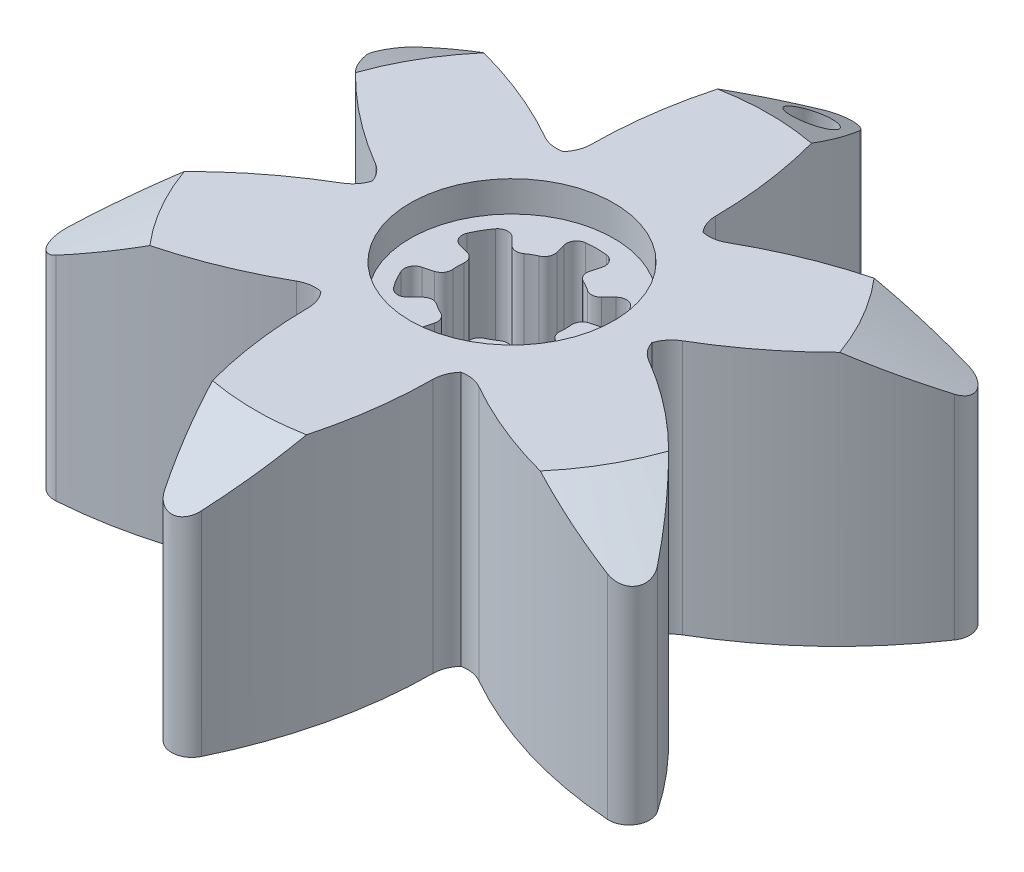
from build123d import *

# Parameters (mm, degrees)
SKETCH1_R               = 17.8
BOSS_EXTRUDE1_DEPTH     = 12.5
CHAMFER1_SIZE           = 3
CHAMFER1_SIZE2          = 5.196152423
CUT_EXTRUDE1_DEPTH      = 29.105693373
CUT_EXTRUDE2_DEPTH      = 27.659332496
SKETCH3_3_R             = 5
SKETCH3_3_R_2           = 4.15
CUT_EXTRUDE3_DEPTH      = 1.5
FILLET1_R               = 1
FILLET2_R               = 1.5
CUT_EXTRUDE4_DEPTH      = 26.464179365
CUT_EXTRUDE4_DEPTH_BACK = 9
SKETCH5_R               = 1
CUT_EXTRUDE5_DEPTH      = 26.464179365
FILLET3_R               = 0.5


with BuildPart() as part:
    # Sketch1 → Boss-Extrude1 (new body)
    with BuildSketch(Plane(origin=(0, 0, 0), x_dir=(1, 0, 0), z_dir=(0, 1, 0))):
        with Locations(Location((0, 0, 0), (0, 0, 270))):
            Circle(SKETCH1_R)
    extrude(amount=BOSS_EXTRUDE1_DEPTH)

    # Chamfer1
    chamfer1_edges = [part.edges().sort_by_distance(p)[0] for p in [
        (0, 12.5, -17.8),
    ]]
    chamfer1_side = [part.faces().sort_by_distance(p)[0] for p in [
        (0, 6.25, -17.8),
    ]]
    chamfer(chamfer1_edges, length=CHAMFER1_SIZE, length2=CHAMFER1_SIZE2, reference=chamfer1_side[0])

    # Sketch2 → Cut-Extrude1 (cut, through all)
    with BuildSketch(Plane(origin=(0, 12.5, 0), x_dir=(1, 0, 0), z_dir=(0, 1, 0))):
        with BuildLine():
            ThreePointArc((15.415252187, 8.9), (8.9, 15.415252187), (0, 17.8))
            ThreePointArc((0, 17.8), (2.273382377, 12.507506023), (3.05, 6.8))
            Line((3.05, 6.8), (3.05, 6.077622891))
            ThreePointArc((3.05, 6.077622891), (3.4, 5.888972746), (3.738375818, 5.680188927))
            Line((3.738375818, 5.680188927), (4.363972746, 6.041377482))
            ThreePointArc((4.363972746, 6.041377482), (9.695126765, 8.222559903), (15.415252187, 8.9))
        make_face()
        with BuildLine():
            ThreePointArc((17.8, 0), (17.193479708, 4.606979003), (15.415252187, 8.9))
            ThreePointArc((15.415252187, 8.9), (11.968509142, 4.28494612), (7.413972746, 0.758622518))
            Line((7.413972746, 0.758622518), (6.788375818, 0.397433964))
            ThreePointArc((6.788375818, 0.397433964), (6.797093333, 0.19880196), (6.8, 0))
            ThreePointArc((6.8, 0), (6.797093333, -0.19880196), (6.788375818, -0.397433964))
            Line((6.788375818, -0.397433964), (7.413972746, -0.758622518))
            ThreePointArc((7.413972746, -0.758622518), (11.968509142, -4.28494612), (15.415252187, -8.9))
            ThreePointArc((15.415252187, -8.9), (17.193479708, -4.606979003), (17.8, 0))
        make_face()
        with BuildLine():
            ThreePointArc((0, -17.8), (8.9, -15.415252187), (15.415252187, -8.9))
            ThreePointArc((15.415252187, -8.9), (9.695126765, -8.222559903), (4.363972746, -6.041377482))
            Line((4.363972746, -6.041377482), (3.738375818, -5.680188927))
            ThreePointArc((3.738375818, -5.680188927), (3.4, -5.888972746), (3.05, -6.077622891))
            Line((3.05, -6.077622891), (3.05, -6.8))
            ThreePointArc((3.05, -6.8), (2.273382377, -12.507506023), (0, -17.8))
        make_face()
        with BuildLine():
            ThreePointArc((-4.363972746, -6.041377482), (-9.695126765, -8.222559903), (-15.415252187, -8.9))
            ThreePointArc((-15.415252187, -8.9), (-8.9, -15.415252187), (0, -17.8))
            ThreePointArc((0, -17.8), (-2.273382377, -12.507506023), (-3.05, -6.8))
            Line((-3.05, -6.8), (-3.05, -6.077622891))
            ThreePointArc((-3.05, -6.077622891), (-3.4, -5.888972746), (-3.738375818, -5.680188927))
            Line((-3.738375818, -5.680188927), (-4.363972746, -6.041377482))
        make_face()
        with BuildLine():
            ThreePointArc((-7.413972746, 0.758622518), (-11.968509142, 4.28494612), (-15.415252187, 8.9))
            ThreePointArc((-15.415252187, 8.9), (-17.8, 0), (-15.415252187, -8.9))
            ThreePointArc((-15.415252187, -8.9), (-11.968509142, -4.28494612), (-7.413972746, -0.758622518))
            Line((-7.413972746, -0.758622518), (-6.788375818, -0.397433964))
            ThreePointArc((-6.788375818, -0.397433964), (-6.8, 0), (-6.788375818, 0.397433964))
            Line((-6.788375818, 0.397433964), (-7.413972746, 0.758622518))
        make_face()
        with BuildLine():
            Line((-3.05, 6.077622891), (-3.05, 6.8))
            ThreePointArc((-3.05, 6.8), (-2.273382377, 12.507506023), (0, 17.8))
            ThreePointArc((0, 17.8), (-8.9, 15.415252187), (-15.415252187, 8.9))
            ThreePointArc((-15.415252187, 8.9), (-9.695126765, 8.222559903), (-4.363972746, 6.041377482))
            Line((-4.363972746, 6.041377482), (-3.738375818, 5.680188927))
            ThreePointArc((-3.738375818, 5.680188927), (-3.4, 5.888972746), (-3.05, 6.077622891))
        make_face()
    extrude(amount=-CUT_EXTRUDE1_DEPTH, mode=Mode.SUBTRACT)

    # Sketch3 → Cut-Extrude2 (cut, through all)
    with BuildSketch(Plane(origin=(0, 12.5, 0), x_dir=(1, 0, 0), z_dir=(0, 1, 0))):
        with BuildLine():
            ThreePointArc((1.87383297, 1.87383297), (1.325, 2.29496732), (0.68587047, 2.55970344))
            Line((0.68587047, 2.55970344), (1.074099037, 4.008592179))
            ThreePointArc((1.074099037, 4.008592179), (0, 4.15), (-1.074099037, 4.008592179))
            Line((-1.074099037, 4.008592179), (-0.68587047, 2.55970344))
            ThreePointArc((-0.68587047, 2.55970344), (-1.325, 2.29496732), (-1.87383297, 1.87383297))
            Line((-1.87383297, 1.87383297), (-2.934493142, 2.934493142))
            ThreePointArc((-2.934493142, 2.934493142), (-3.594005426, 2.075), (-4.008592179, 1.074099037))
            Line((-4.008592179, 1.074099037), (-2.55970344, 0.68587047))
            ThreePointArc((-2.55970344, 0.68587047), (-2.65, 0), (-2.55970344, -0.68587047))
            Line((-2.55970344, -0.68587047), (-4.008592179, -1.074099037))
            ThreePointArc((-4.008592179, -1.074099037), (-3.594005426, -2.075), (-2.934493142, -2.934493142))
            Line((-2.934493142, -2.934493142), (-1.87383297, -1.87383297))
            ThreePointArc((-1.87383297, -1.87383297), (-1.325, -2.29496732), (-0.68587047, -2.55970344))
            Line((-0.68587047, -2.55970344), (-1.074099037, -4.008592179))
            ThreePointArc((-1.074099037, -4.008592179), (0, -4.15), (1.074099037, -4.008592179))
            Line((1.074099037, -4.008592179), (0.68587047, -2.55970344))
            ThreePointArc((0.68587047, -2.55970344), (1.325, -2.29496732), (1.87383297, -1.87383297))
            Line((1.87383297, -1.87383297), (2.934493142, -2.934493142))
            ThreePointArc((2.934493142, -2.934493142), (3.594005426, -2.075), (4.008592179, -1.074099037))
            Line((4.008592179, -1.074099037), (2.55970344, -0.68587047))
            ThreePointArc((2.55970344, -0.68587047), (2.65, 0), (2.55970344, 0.68587047))
            Line((2.55970344, 0.68587047), (4.008592179, 1.074099037))
            ThreePointArc((4.008592179, 1.074099037), (3.594005426, 2.075), (2.934493142, 2.934493142))
            Line((2.934493142, 2.934493142), (1.87383297, 1.87383297))
        make_face()
    extrude(amount=-CUT_EXTRUDE2_DEPTH, mode=Mode.SUBTRACT)

    # Sketch3<3> → Cut-Extrude3 (cut)
    # profile 1 of 7: a face of its own
    with BuildSketch(Plane(origin=(0, 12.5, 0), x_dir=(1, 0, 0), z_dir=(0, 1, 0))):
        with Locations(Location((0, 0, 0), (0, 0, 270))):
            Circle(SKETCH3_3_R)
        Circle(SKETCH3_3_R_2, mode=Mode.SUBTRACT)
    # profile 2 of 7: a face of its own
    with BuildSketch(Plane(origin=(0, 12.5, 0), x_dir=(1, 0, 0), z_dir=(0, 1, 0))):
        with BuildLine():
            Line((1.074099037, 4.008592179), (0.68587047, 2.55970344))
            ThreePointArc((0.68587047, 2.55970344), (1.325, 2.29496732), (1.87383297, 1.87383297))
            Line((1.87383297, 1.87383297), (2.934493142, 2.934493142))
            ThreePointArc((2.934493142, 2.934493142), (2.075, 3.594005426), (1.074099037, 4.008592179))
        make_face()
    # profile 3 of 7: a face of its own
    with BuildSketch(Plane(origin=(0, 12.5, 0), x_dir=(1, 0, 0), z_dir=(0, 1, 0))):
        with BuildLine():
            Line((-0.68587047, 2.55970344), (-1.074099037, 4.008592179))
            ThreePointArc((-1.074099037, 4.008592179), (-2.075, 3.594005426), (-2.934493142, 2.934493142))
            Line((-2.934493142, 2.934493142), (-1.87383297, 1.87383297))
            ThreePointArc((-1.87383297, 1.87383297), (-1.325, 2.29496732), (-0.68587047, 2.55970344))
        make_face()
    # profile 4 of 7: a face of its own
    with BuildSketch(Plane(origin=(0, 12.5, 0), x_dir=(1, 0, 0), z_dir=(0, 1, 0))):
        with BuildLine():
            Line((-2.55970344, 0.68587047), (-4.008592179, 1.074099037))
            ThreePointArc((-4.008592179, 1.074099037), (-4.15, 0), (-4.008592179, -1.074099037))
            Line((-4.008592179, -1.074099037), (-2.55970344, -0.68587047))
            ThreePointArc((-2.55970344, -0.68587047), (-2.65, 0), (-2.55970344, 0.68587047))
        make_face()
    # profile 5 of 7: a face of its own
    with BuildSketch(Plane(origin=(0, 12.5, 0), x_dir=(1, 0, 0), z_dir=(0, 1, 0))):
        with BuildLine():
            Line((-1.87383297, -1.87383297), (-2.934493142, -2.934493142))
            ThreePointArc((-2.934493142, -2.934493142), (-2.075, -3.594005426), (-1.074099037, -4.008592179))
            Line((-1.074099037, -4.008592179), (-0.68587047, -2.55970344))
            ThreePointArc((-0.68587047, -2.55970344), (-1.325, -2.29496732), (-1.87383297, -1.87383297))
        make_face()
    # profile 6 of 7: a face of its own
    with BuildSketch(Plane(origin=(0, 12.5, 0), x_dir=(1, 0, 0), z_dir=(0, 1, 0))):
        with BuildLine():
            ThreePointArc((1.074099037, -4.008592179), (2.075, -3.594005426), (2.934493142, -2.934493142))
            Line((2.934493142, -2.934493142), (1.87383297, -1.87383297))
            ThreePointArc((1.87383297, -1.87383297), (1.325, -2.29496732), (0.68587047, -2.55970344))
            Line((0.68587047, -2.55970344), (1.074099037, -4.008592179))
        make_face()
    # profile 7 of 7: a face of its own
    with BuildSketch(Plane(origin=(0, 12.5, 0), x_dir=(1, 0, 0), z_dir=(0, 1, 0))):
        with BuildLine():
            ThreePointArc((4.15, 0), (4.114496175, 0.541683698), (4.008592179, 1.074099037))
            Line((4.008592179, 1.074099037), (2.55970344, 0.68587047))
            ThreePointArc((2.55970344, 0.68587047), (2.65, 0), (2.55970344, -0.68587047))
            Line((2.55970344, -0.68587047), (4.008592179, -1.074099037))
            ThreePointArc((4.008592179, -1.074099037), (4.114496175, -0.541683698), (4.15, 0))
        make_face()
    extrude(amount=-CUT_EXTRUDE3_DEPTH, mode=Mode.SUBTRACT)

    # Fillet1
    fillet1_edges = [part.edges().sort_by_distance(p)[0] for p in [
        (-15.415252187, 4.75, 8.9),
        (-15.415252187, 4.75, -8.9),
        (0, 4.75, -17.8),
        (15.415252187, 4.75, -8.9),
        (0, 4.75, 17.8),
        (15.415252187, 4.75, 8.9),
    ]]
    fillet(fillet1_edges, radius=FILLET1_R)

    # Fillet2
    # the kernel refuses this fillet: 1.5 mm, written as the material it adds along each edge
    with BuildSketch(Plane(origin=(3.05, 12.5, 6.077622891), x_dir=(-0.00048199779843659105, 0, 0.9999998838390544), z_dir=(0, -1, 0)), Plane(origin=(6.788375818, 12.5, 0.397433964), x_dir=(0.8657843042869479, 0, 0.5004173642574423), z_dir=(0, -1, 0)), Plane(origin=(3.738375818, 12.5, -5.680188927), x_dir=(0.8662663020854502, 0, -0.4995825195812995), z_dir=(0, -1, 0))) as fillet2_piece_1:
        with BuildLine():
            CenterArc((0.863665004, -1.499975376), FILLET2_R, 90.328301817, 56.404604644)
            Line((-0.390518808, -0.677161324), (-0.515937189, -0.594879918))
            ThreePointArc((-0.515937189, -0.594879918), (-0.315461308, -0.269260246), (-0.134032767, 0.067344023))
            Line((-0.134032767, 0.067344023), (7.23e-05, 0.149999983))
            ThreePointArc((7.23e-05, 0.149999983), (0.722449325, 0.149651798), (0.854210642, 0.149997538))
            Line((0.854210642, 0.149997538), (0.85507013, 0))
        make_face()
    extrude(amount=12.5)
    with BuildSketch(Plane(origin=(3.738375818, 12.5, 5.680188927), x_dir=(-0.8655400074803123, 0, 0.5008397902033951), z_dir=(0, -1, 0)), Plane(origin=(6.788375818, 12.5, -0.397433964), x_dir=(0.0009699778017299519, 0, 0.9999995295714215), z_dir=(0, -1, 0)), Plane(origin=(3.05, 12.5, -6.077622891), x_dir=(0.8665099852823465, 0, 0.49915973936805796), z_dir=(0, -1, 0))) as fillet2_piece_2:
        with BuildLine():
            CenterArc((0.867915142, -1.497520175), FILLET2_R, 93.295052741, 56.404604644)
            Line((-0.427173659, -0.740720995), (-0.556682539, -0.665041077))
            ThreePointArc((-0.556682539, -0.665041077), (-0.490558067, -0.551073018), (-0.129976498, 0.074873961))
            Line((-0.129976498, 0.074873961), (0.008621674, 0.149752017))
            ThreePointArc((0.008621674, 0.149752017), (0.390849203, 0.138758127), (0.773076732, 0.149752017))
            Line((0.773076732, 0.149752017), (0.781698406, 0))
        make_face()
    extrude(amount=12.5)
    with BuildSketch(Plane(origin=(-3.738375818, 12.5, 5.680188927), x_dir=(0.8655400074804652, 0, 0.5008397902031311), z_dir=(0, -1, 0)), Plane(origin=(-6.788375818, 12.5, -0.397433964), x_dir=(-0.0009699778021795972, 0, 0.999999529571421), z_dir=(0, -1, 0)), Plane(origin=(-3.05, 12.5, -6.077622891), x_dir=(-0.8665099852823467, 0, 0.49915973936805774), z_dir=(0, -1, 0))) as fillet2_piece_3:
        with BuildLine():
            CenterArc((0.867915142, 1.497520175), FILLET2_R, 210.300342615, 56.404604644)
            Line((-0.427173659, 0.740720995), (-0.556682539, 0.665041077))
            ThreePointArc((-0.556682539, 0.665041077), (-0.490558067, 0.551073018), (-0.129976498, -0.074873961))
            Line((-0.129976498, -0.074873961), (0.008621674, -0.149752017))
            ThreePointArc((0.008621674, -0.149752017), (0.390849203, -0.138758127), (0.773076732, -0.149752017))
            Line((0.773076732, -0.149752017), (0.781698406, 0))
        make_face()
    extrude(amount=12.5)
    with BuildSketch(Plane(origin=(-3.05, 12.5, 6.077622891), x_dir=(0.00048199779885955805, 0, 0.9999998838390541), z_dir=(0, -1, 0)), Plane(origin=(-6.788375818, 12.5, 0.397433964), x_dir=(-0.8657843042866001, 0, 0.500417364258044), z_dir=(0, -1, 0)), Plane(origin=(-3.738375818, 12.5, -5.680188927), x_dir=(-0.8662663020855745, 0, -0.49958251958108396), z_dir=(0, -1, 0))) as fillet2_piece_4:
        with BuildLine():
            CenterArc((0.863665004, 1.499975376), FILLET2_R, 213.267093538, 56.404604644)
            Line((-0.390518808, 0.677161324), (-0.515937189, 0.594879918))
            ThreePointArc((-0.515937189, 0.594879918), (-0.315461308, 0.269260246), (-0.134032767, -0.067344023))
            Line((-0.134032767, -0.067344023), (7.23e-05, -0.149999983))
            ThreePointArc((7.23e-05, -0.149999983), (0.722449325, -0.149651798), (0.854210642, -0.149997538))
            Line((0.854210642, -0.149997538), (0.85507013, 0))
        make_face()
    extrude(amount=12.5)

    # Sketch4 → Cut-Extrude4 (cut, two sides: drawn at the far end of the back side and taken through both)
    with BuildSketch(Plane.XZ.offset(-CUT_EXTRUDE4_DEPTH_BACK)):
        with BuildLine():
            ThreePointArc((-2.219953239, 4.480157097), (0, 5), (2.219953239, 4.480157097))
            Line((2.219953239, 4.480157097), (2.5, 4.965212315))
            Line((2.5, 4.965212315), (2.770864683, 5.434363708))
            ThreePointArc((2.770864683, 5.434363708), (2.685698645, 5.476953787), (2.599878168, 5.518209267))
            ThreePointArc((2.599878168, 5.518209267), (2.187128312, 5.878639709), (2.02629493, 6.402476679))
            ThreePointArc((2.02629493, 6.402476679), (1.516680759, 10.735395398), (0.183644193, 14.889538481))
            ThreePointArc((0.183644193, 14.889538481), (0, 15.010324782), (-0.183644193, 14.889538481))
            ThreePointArc((-0.183644193, 14.889538481), (-1.516680759, 10.735395398), (-2.02629493, 6.402476679))
            ThreePointArc((-2.02629493, 6.402476679), (-2.187128312, 5.878639709), (-2.599878168, 5.518209267))
            ThreePointArc((-2.599878168, 5.518209267), (-2.685698645, 5.476953787), (-2.770864683, 5.434363708))
            Line((-2.770864683, 5.434363708), (-2.219953239, 4.480157097))
        make_face()
        with BuildLine():
            ThreePointArc((-4.989906479, 0.317542648), (-4.330127019, 2.5), (-2.769953239, 4.162614449))
            Line((-2.769953239, 4.162614449), (-3.320864683, 5.11682106))
            ThreePointArc((-3.320864683, 5.11682106), (-3.400331793, 5.064360147), (-3.478970325, 5.010665174))
            ThreePointArc((-3.478970325, 5.010665174), (-3.997487172, 4.833428534), (-4.531559986, 4.956061224))
            ThreePointArc((-4.531559986, 4.956061224), (-8.538784755, 6.681181766), (-12.802896479, 7.603809777))
            ThreePointArc((-12.802896479, 7.603809777), (-12.99932258, 7.505162391), (-12.986540672, 7.285728704))
            ThreePointArc((-12.986540672, 7.285728704), (-10.055465514, 4.054213633), (-6.557854916, 1.446415454))
            ThreePointArc((-6.557854916, 1.446415454), (-6.184615484, 1.045211175), (-6.078848492, 0.507544093))
            ThreePointArc((-6.078848492, 0.507544093), (-6.086030438, 0.41259364), (-6.091729366, 0.317542648))
            Line((-6.091729366, 0.317542648), (-4.989906479, 0.317542648))
        make_face()
        with BuildLine():
            Line((-3.320864683, -5.11682106), (-2.769953239, -4.162614449))
            ThreePointArc((-2.769953239, -4.162614449), (-4.330127019, -2.5), (-4.989906479, -0.317542648))
            Line((-4.989906479, -0.317542648), (-6.091729366, -0.317542648))
            ThreePointArc((-6.091729366, -0.317542648), (-6.086030438, -0.41259364), (-6.078848492, -0.507544093))
            ThreePointArc((-6.078848492, -0.507544093), (-6.184615484, -1.045211175), (-6.557854916, -1.446415454))
            ThreePointArc((-6.557854916, -1.446415454), (-10.055465514, -4.054213633), (-12.986540672, -7.285728704))
            ThreePointArc((-12.986540672, -7.285728704), (-12.99932258, -7.505162391), (-12.802896479, -7.603809777))
            ThreePointArc((-12.802896479, -7.603809777), (-8.538784755, -6.681181766), (-4.531559986, -4.956061224))
            ThreePointArc((-4.531559986, -4.956061224), (-3.997487172, -4.833428534), (-3.478970324, -5.010665174))
            ThreePointArc((-3.478970324, -5.010665174), (-3.400331793, -5.064360147), (-3.320864683, -5.11682106))
        make_face()
        with BuildLine():
            Line((2.770864683, -5.434363708), (2.219953239, -4.480157097))
            ThreePointArc((2.219953239, -4.480157097), (0, -5), (-2.219953239, -4.480157097))
            Line((-2.219953239, -4.480157097), (-2.770864683, -5.434363708))
            ThreePointArc((-2.770864683, -5.434363708), (-2.685698645, -5.476953787), (-2.599878168, -5.518209267))
            ThreePointArc((-2.599878168, -5.518209267), (-2.187128312, -5.878639709), (-2.02629493, -6.402476679))
            ThreePointArc((-2.02629493, -6.402476679), (-1.516680759, -10.735395398), (-0.183644193, -14.889538481))
            ThreePointArc((-0.183644193, -14.889538481), (0, -15.010324782), (0.183644193, -14.889538481))
            ThreePointArc((0.183644193, -14.889538481), (1.516680759, -10.735395398), (2.02629493, -6.402476679))
            ThreePointArc((2.02629493, -6.402476679), (2.187128312, -5.878639709), (2.599878168, -5.518209267))
            ThreePointArc((2.599878168, -5.518209267), (2.685698645, -5.476953787), (2.770864683, -5.434363708))
        make_face()
        with BuildLine():
            ThreePointArc((6.078848492, -0.507544093), (6.086030438, -0.41259364), (6.091729366, -0.317542648))
            Line((6.091729366, -0.317542648), (4.989906479, -0.317542648))
            ThreePointArc((4.989906479, -0.317542648), (4.330127019, -2.5), (2.769953239, -4.162614449))
            Line((2.769953239, -4.162614449), (3.320864683, -5.11682106))
            ThreePointArc((3.320864683, -5.11682106), (3.400331793, -5.064360147), (3.478970325, -5.010665174))
            ThreePointArc((3.478970325, -5.010665174), (3.997487172, -4.833428534), (4.531559986, -4.956061224))
            ThreePointArc((4.531559986, -4.956061224), (8.538784755, -6.681181766), (12.802896479, -7.603809777))
            ThreePointArc((12.802896479, -7.603809777), (12.99932258, -7.505162391), (12.986540672, -7.285728704))
            ThreePointArc((12.986540672, -7.285728704), (10.055465514, -4.054213633), (6.557854916, -1.446415454))
            ThreePointArc((6.557854916, -1.446415454), (6.184615484, -1.045211175), (6.078848492, -0.507544093))
        make_face()
        with BuildLine():
            Line((4.989906479, 0.317542648), (6.091729366, 0.317542648))
            ThreePointArc((6.091729366, 0.317542648), (6.086030438, 0.41259364), (6.078848492, 0.507544093))
            ThreePointArc((6.078848492, 0.507544093), (6.184615484, 1.045211175), (6.557854916, 1.446415454))
            ThreePointArc((6.557854916, 1.446415454), (10.055465514, 4.054213633), (12.986540672, 7.285728704))
            ThreePointArc((12.986540672, 7.285728704), (12.99932258, 7.505162391), (12.802896479, 7.603809777))
            ThreePointArc((12.802896479, 7.603809777), (8.538784755, 6.681181766), (4.531559986, 4.956061224))
            ThreePointArc((4.531559986, 4.956061224), (3.997487172, 4.833428534), (3.478970324, 5.010665174))
            ThreePointArc((3.478970324, 5.010665174), (3.400331793, 5.064360147), (3.320864683, 5.11682106))
            Line((3.320864683, 5.11682106), (3.05, 4.647669667))
            Line((3.05, 4.647669667), (2.769953239, 4.162614449))
            ThreePointArc((2.769953239, 4.162614449), (4.330127019, 2.5), (4.989906479, 0.317542648))
        make_face()
    extrude(amount=CUT_EXTRUDE4_DEPTH + CUT_EXTRUDE4_DEPTH_BACK, mode=Mode.SUBTRACT)

    # Sketch5 → Cut-Extrude5 (cut, through all)
    with BuildSketch(Plane(origin=(0, 12.5, 0), x_dir=(1, 0, 0), z_dir=(0, 1, 0))):
        with Locations(Location((0, 14.70381204, 0), (0, 0, 234.155735343))):
            Circle(SKETCH5_R)
    extrude(amount=-CUT_EXTRUDE5_DEPTH, mode=Mode.SUBTRACT)

    # Fillet3
    fillet3_edges = [part.edges().sort_by_distance(p)[0] for p in [
        (-2.55970344, 5.5, -0.68587047),
        (-4.008592179, 5.5, -1.074099037),
        (-2.934493142, 5.5, -2.934493142),
        (-1.87383297, 5.5, -1.87383297),
        (-0.68587047, 5.5, -2.55970344),
        (-1.074099037, 5.5, -4.008592179),
        (1.074099037, 5.5, -4.008592179),
        (0.68587047, 5.5, -2.55970344),
        (1.87383297, 5.5, -1.87383297),
        (2.934493142, 5.5, -2.934493142),
        (4.008592179, 5.5, -1.074099037),
        (2.55970344, 5.5, -0.68587047),
        (2.55970344, 5.5, 0.68587047),
        (4.008592179, 5.5, 1.074099037),
        (2.934493142, 5.5, 2.934493142),
        (1.87383297, 5.5, 1.87383297),
        (0.68587047, 5.5, 2.55970344),
        (1.074099037, 5.5, 4.008592179),
        (-1.074099037, 5.5, 4.008592179),
        (-0.68587047, 5.5, 2.55970344),
        (-1.87383297, 5.5, 1.87383297),
        (-2.934493142, 5.5, 2.934493142),
        (-4.008592179, 5.5, 1.074099037),
        (-2.55970344, 5.5, 0.68587047),
    ]]
    fillet(fillet3_edges, radius=FILLET3_R)


solid = part.part
